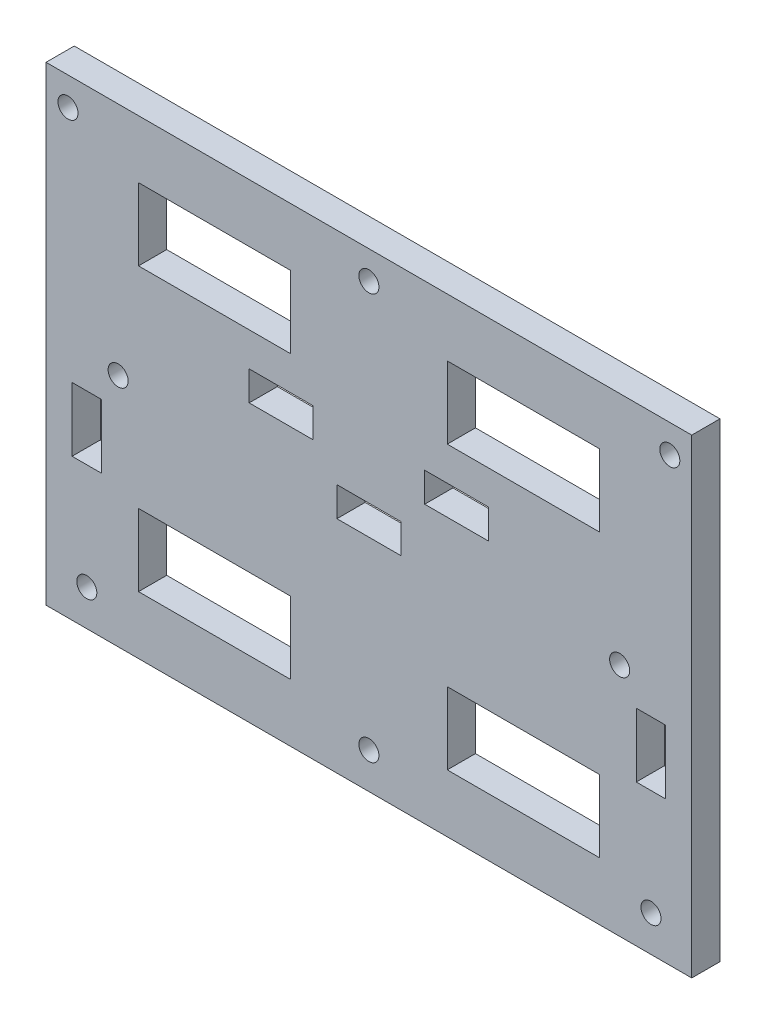
from build123d import *

# Parameters (mm, degrees)
SKETCH1_W           = 103
SKETCH1_H           = 75
SKETCH1_W_2         = 24.25
SKETCH1_H_2         = 11.5
BOSS_EXTRUDE1_DEPTH = 4.5
SKETCH2_R           = 1.6
SCREWHOLES_DEPTH    = 64.865092187
SKETCH3_W           = 10.2
SKETCH3_H           = 4.7
BELTCLAMP_DEPTH     = 64.865092187
SKETCH4_W           = 10.2
SKETCH4_H           = 4.7
CUT_EXTRUDE3_DEPTH  = 64.865092187
SKETCH5_R           = 1.6
SKETCH5_W           = 4.7
SKETCH5_H           = 10.2
CUT_EXTRUDE4_DEPTH  = 64.865092187


with BuildPart() as part:
    # Sketch1 → Boss-Extrude1 (new body)
    with BuildSketch(Plane.XY):
        Rectangle(SKETCH1_W, SKETCH1_H)
        with Locations((-24.625, 22.5)):
            Rectangle(SKETCH1_W_2, SKETCH1_H_2, mode=Mode.SUBTRACT)
        with Locations((24.625, 22.5)):
            Rectangle(SKETCH1_W_2, SKETCH1_H_2, mode=Mode.SUBTRACT)
        with Locations((24.625, -22.5)):
            Rectangle(SKETCH1_W_2, SKETCH1_H_2, mode=Mode.SUBTRACT)
        with Locations((-24.625, -22.5)):
            Rectangle(SKETCH1_W_2, SKETCH1_H_2, mode=Mode.SUBTRACT)
    extrude(amount=BOSS_EXTRUDE1_DEPTH)

    # Sketch2 → screwHoles (cut, through all)
    with BuildSketch(Plane.XY.offset(4.5)):
        with Locations((-48, 33)):
            Circle(SKETCH2_R)
        with Locations((48, 33)):
            Circle(SKETCH2_R)
        with Locations((40, 0)):
            Circle(SKETCH2_R)
        with Locations((-40, 0)):
            Circle(SKETCH2_R)
        with Locations((0, 33)):
            Circle(SKETCH2_R)
    extrude(amount=-SCREWHOLES_DEPTH, mode=Mode.SUBTRACT)

    # Sketch3 → BeltClamp (cut, through all)
    with BuildSketch(Plane.XY.offset(4.5)):
        with Locations((-14, 9)):
            Rectangle(SKETCH3_W, SKETCH3_H)
        with Locations((14, 9)):
            Rectangle(SKETCH3_W, SKETCH3_H)
    extrude(amount=-BELTCLAMP_DEPTH, mode=Mode.SUBTRACT)

    # Sketch4 → Cut-Extrude3 (cut, through all)
    with BuildSketch(Plane.XY.offset(4.5)):
        Rectangle(SKETCH4_W, SKETCH4_H)
    extrude(amount=-CUT_EXTRUDE3_DEPTH, mode=Mode.SUBTRACT)

    # Sketch5 → Cut-Extrude4 (cut, through all)
    with BuildSketch(Plane.XY.offset(4.5)):
        with Locations((45, -31.75)):
            Circle(SKETCH5_R)
        with Locations((-45, -31.75)):
            Circle(SKETCH5_R)
        with Locations((0, -31.75)):
            Circle(SKETCH5_R)
        with Locations((45, -9.75)):
            Rectangle(SKETCH5_W, SKETCH5_H)
        with Locations((-45, -9.75)):
            Rectangle(SKETCH5_W, SKETCH5_H)
    extrude(amount=-CUT_EXTRUDE4_DEPTH, mode=Mode.SUBTRACT)


solid = part.part
